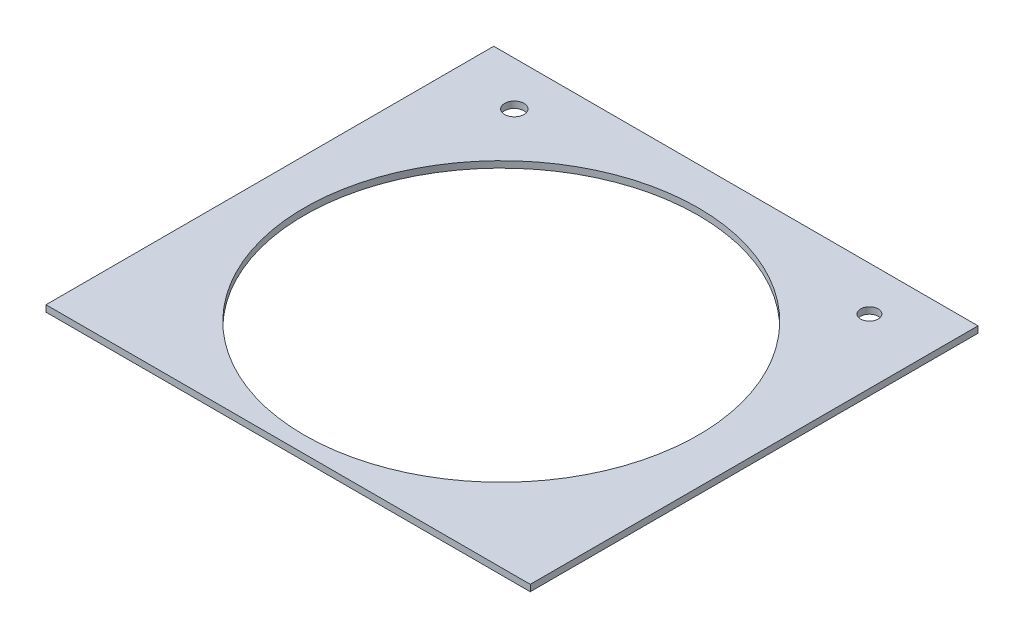
from build123d import *

# Parameters (mm, degrees)
SKETCH1_W           = 75
SKETCH1_H           = 69.344557783
SKETCH1_R           = 1.5
SKETCH1_R_2         = 1.363636364
SKETCH1_R_3         = 30.5
BOSS_EXTRUDE1_DEPTH = 1


with BuildPart() as part:
    # Sketch1 → Boss-Extrude1 (new body)
    with BuildSketch(Plane(origin=(0, 0, 0), x_dir=(1, 0, 0), z_dir=(0, 1, 0))):
        with Locations((0, 0.162321047)):
            Rectangle(SKETCH1_W, SKETCH1_H)
        with Locations((-27.5, 28.016418119)):
            Circle(SKETCH1_R, mode=Mode.SUBTRACT)
        with Locations((27.5, 28.016418119)):
            Circle(SKETCH1_R_2, mode=Mode.SUBTRACT)
        with Locations((0, -1.5)):
            Circle(SKETCH1_R_3, mode=Mode.SUBTRACT)
    extrude(amount=BOSS_EXTRUDE1_DEPTH)


solid = part.part
